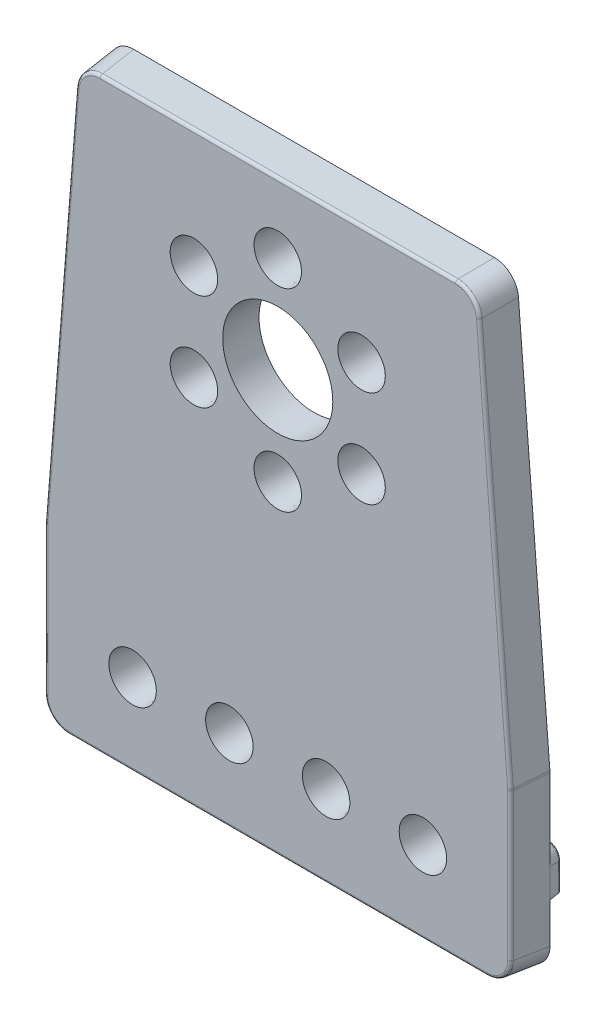
from build123d import *

# Parameters (mm, degrees)
BOSS_EXTRUDE1_DEPTH            = 3
BOSS_EXTRUDE1_DRAFT            = -5
SKETCH2_W                      = 39
SKETCH2_H                      = 3.4
BOSS_EXTRUDE2_DEPTH            = 1
BOSS_EXTRUDE2_TAPER            = 5
HOLE1_AT_2_COUNT               = 2
HOLE1_AT_2_PITCH               = 8
HOLE1_AT_3_COUNT               = 2
HOLE1_AT_3_PITCH               = 13.856406461
HOLE1_AT_4_COUNT               = 2
HOLE1_AT_4_PITCH               = 13.856406461
HOLE1_AT_5_COUNT               = 2
HOLE1_AT_5_PITCH               = 8
HOLE1_AT_6_COUNT               = 2
HOLE1_AT_6_PITCH               = 16
F_9_1_9_1_DIAMETER_HOLE1_D     = 9.1
F_9_1_9_1_DIAMETER_HOLE1_DEPTH = 4.000025
FILLET2_R                      = 1
FILLET3_R                      = 2
FILLET4_R                      = 0.250154439


with BuildPart() as part:
    # Sketch1 → Boss-Extrude1 (with draft: the straight prism first)
    with BuildSketch(Plane(origin=(0, 0, 0), x_dir=(-1, 0, 0), z_dir=(0, 0, -1))):
        Polygon((19.5, -20.5), (16.75, 14), (-16.75, 14), (-19.5, -20.5), (-19.5, -35), (19.5, -35), align=None)
    extrude(amount=-BOSS_EXTRUDE1_DEPTH)
    # Boss-Extrude1: the draft: its side faces are tilted about the plane it starts from
    boss_extrude1_sides = [part.faces().sort_by_distance(p)[0] for p in [
        (-18.125, -3.25, 1.5),
        (0, 14, 1.5),
        (18.125, -3.25, 1.5),
        (19.5, -27.75, 1.5),
        (0, -35, 1.5),
        (-19.5, -27.75, 1.5),
    ]]
    draft(boss_extrude1_sides, Plane(origin=(0, 0, 0), x_dir=(-1, 0, 0), z_dir=(0, 0, -1)), BOSS_EXTRUDE1_DRAFT)

    # Sketch2 → Boss-Extrude2 (add)
    with BuildSketch(Plane(origin=(0, 0, 0), x_dir=(-1, 0, 0), z_dir=(0, 0, -1))):
        with Locations((0, -28)):
            Rectangle(SKETCH2_W, SKETCH2_H)
    extrude(amount=BOSS_EXTRUDE2_DEPTH, taper=BOSS_EXTRUDE2_TAPER)

    # Sketch3 → Cut-Revolve1 (revolve, cut)
    with BuildSketch(Plane.XZ.offset(28), mode=Mode.PRIVATE) as cut_revolve1_sk:
        Polygon((-2.03753401, 3), (-4, 3), (-4, -1), (-2.212511337, -1), (-2.3, 0), align=None)
    revolve(cut_revolve1_sk.sketch.rotate(Axis((-4, -28, 3), (0, 0, -1)), 90), axis=Axis((-4, -28, 3), (0, 0, -1)), mode=Mode.SUBTRACT)

    # Sketch4 → Cut-Revolve2 (revolve, cut)
    with BuildSketch(Plane.XZ.offset(28), mode=Mode.PRIVATE) as cut_revolve2_sk:
        Polygon((-10.03753401, 3), (-12, 3), (-12, -1), (-10.212511337, -1), (-10.3, 0), align=None)
    revolve(cut_revolve2_sk.sketch.rotate(Axis((-12, -28, 3), (0, 0, -1)), 90), axis=Axis((-12, -28, 3), (0, 0, -1)), mode=Mode.SUBTRACT)

    # Sketch5 → Cut-Revolve3 (revolve, cut)
    with BuildSketch(Plane.XZ.offset(28), mode=Mode.PRIVATE) as cut_revolve3_sk:
        Polygon((5.96246599, 3), (4, 3), (4, -1), (5.787488663, -1), (5.7, 0), align=None)
    revolve(cut_revolve3_sk.sketch.rotate(Axis((4, -28, 3), (0, 0, -1)), 90), axis=Axis((4, -28, 3), (0, 0, -1)), mode=Mode.SUBTRACT)

    # Sketch6 → Cut-Revolve4 (revolve, cut)
    with BuildSketch(Plane.XZ.offset(28), mode=Mode.PRIVATE) as cut_revolve4_sk:
        Polygon((13.96246599, 3), (12, 3), (12, -1), (13.787488663, -1), (13.7, 0), align=None)
    revolve(cut_revolve4_sk.sketch.rotate(Axis((12, -28, 3), (0, 0, -1)), 90), axis=Axis((12, -28, 3), (0, 0, -1)), mode=Mode.SUBTRACT)

    # Sketch7 → Hole1 (revolve, cut)
    with BuildSketch(Plane(origin=(-6.92820323, 4, 3), x_dir=(0, -1, 0), z_dir=(1, 0, 0))):
        Polygon((0, 0), (0, 3), (1.7, 3), (1.96246599, 0), align=None)
    hole1 = revolve(axis=Axis((-6.92820323, 4, -107), (0, 0, 1)), mode=Mode.SUBTRACT)

    # Hole1 at 2: Hole1 ×2
    with Locations(*[Vector(0.8660254037844387, 0.4999999999999999, 0) * (i * HOLE1_AT_2_PITCH) for i in range(1, HOLE1_AT_2_COUNT)]):
        add(hole1, mode=Mode.SUBTRACT)

    # Hole1 at 3: Hole1 ×2
    with Locations(*[Vector(0.49999999999999983, -0.8660254037844388, 0) * (i * HOLE1_AT_3_PITCH) for i in range(1, HOLE1_AT_3_COUNT)]):
        add(hole1, mode=Mode.SUBTRACT)

    # Hole1 at 4: Hole1 ×2
    with Locations(*[(i * HOLE1_AT_4_PITCH, 0, 0) for i in range(1, HOLE1_AT_4_COUNT)]):
        add(hole1, mode=Mode.SUBTRACT)

    # Hole1 at 5: Hole1 ×2
    with Locations(*[(0, -i * HOLE1_AT_5_PITCH, 0) for i in range(1, HOLE1_AT_5_COUNT)]):
        add(hole1, mode=Mode.SUBTRACT)

    # Hole1 at 6: Hole1 ×2
    with Locations(*[Vector(0.8660254037844387, -0.5, 0) * (i * HOLE1_AT_6_PITCH) for i in range(1, HOLE1_AT_6_COUNT)]):
        add(hole1, mode=Mode.SUBTRACT)

    # Ø9.1 (9.1) Diameter Hole1
    with Locations(Plane.XY.offset(3)):
        with Locations((0, 0)):
            Hole(F_9_1_9_1_DIAMETER_HOLE1_D / 2, depth=F_9_1_9_1_DIAMETER_HOLE1_DEPTH)

    # Fillet2
    fillet2_edges = [part.edges().sort_by_distance(p)[0] for p in [
        (19.456255668, -26.343744332, -0.5),
    ]]
    fillet(fillet2_edges, radius=FILLET2_R)

    # Fillet3
    # the kernel refuses this fillet: 2 mm, written as the material it takes off along each edge
    with BuildSketch(Plane(origin=(19.517274298, -20.499312622, -0.197446131), x_dir=(0.00030226286945323497, -0.9999939862011833, -0.0034548804068170054), z_dir=(-0.08715521861055191, -0.003468077488704389, 0.9961887071772493)), Plane(origin=(-19.517274298, -20.499312622, -0.197446131), x_dir=(0.07915633279107509, 0.9968562277382045, -0.003454880406819779), z_dir=(0.08715521861055195, -0.0034680774887046943, 0.9961887071772493))) as fillet3_piece_1:
        with BuildLine():
            CenterArc((FILLET3_R * 0.0396403070859, -FILLET3_R), FILLET3_R, 90, 4.540067567)
            Line((-FILLET3_R * 0.0395159246289, -FILLET3_R * 0.00313777733294), (0, 0))
            Line((0, 0), (FILLET3_R * 0.0396403070859, 0))
        make_face()
    extrude(amount=3.407880694, mode=Mode.SUBTRACT)
    with BuildSketch(Plane(origin=(19.930847672, -35.430847672, -4.924611426), x_dir=(-0.9962234400966148, -0.0075674362784890585, -0.08649619246092513), z_dir=(-0.0868265938642441, 0.08682659386424399, 0.9924325091389677))) as fillet3_piece_2:
        with BuildLine():
            CenterArc((FILLET3_R * 0.992432509139, -FILLET3_R), FILLET3_R, 90, 89.564769998)
            Line((-FILLET3_R * 0.00753863989878, -FILLET3_R * 0.992403876506), (0, 0))
            Line((0, 0), (FILLET3_R * 0.992432509139, 0))
        make_face()
    extrude(amount=12.947200675, mode=Mode.SUBTRACT)
    with BuildSketch(Plane(origin=(17.117827148, 14.398313386, -4.552742838), x_dir=(0.08617201419545477, -0.9930695507218015, -0.07992028152288816), z_dir=(-0.08022556401472408, -0.08687481666807954, 0.9929836983089939)), Plane(origin=(-17.117827148, 14.398313386, -4.552742838), x_dir=(0.9967767347197262, 0.006992118619052054, -0.07992028152288819), z_dir=(0.08022556401472414, -0.08687481666807953, 0.9929836983089939))) as fillet3_piece_3:
        with BuildLine():
            CenterArc((FILLET3_R * 0.916982392707, -FILLET3_R), FILLET3_R, 90, 85.04055089)
            Line((-FILLET3_R * 0.0792737400553, -FILLET3_R * 0.913549332369), (0, 0))
            Line((0, 0), (FILLET3_R * 0.916982392707, 0))
        make_face()
    extrude(amount=12.191021561, mode=Mode.SUBTRACT)
    with BuildSketch(Plane(origin=(-19.930847672, -35.430847672, -4.924611426), x_dir=(0.9962234400966149, -0.007567436278489008, -0.08649619246092499), z_dir=(0.08682659386424396, 0.08682659386424399, 0.9924325091389677))) as fillet3_piece_4:
        with BuildLine():
            CenterArc((FILLET3_R * 0.992432509139, FILLET3_R), FILLET3_R, 180.435230002, 89.564769998)
            Line((-FILLET3_R * 0.00753863989878, FILLET3_R * 0.992403876506), (0, 0))
            Line((0, 0), (FILLET3_R * 0.992432509139, 0))
        make_face()
    extrude(amount=12.947200675, mode=Mode.SUBTRACT)

    # Fillet4
    fillet4_edges = [part.edges().sort_by_distance(p)[0] for p in [
        (0, -29.612511336, -1),
        (5.787488663, -28, -1),
        (2.212511337, -28, -1),
        (-5.787488663, -28, -1),
        (-2.212511337, -28, -1),
        (0, -26.387488664, -1),
        (-16.091911898, -29.612511336, -1),
        (-19.412511336, -28, -1),
        (-13.787488663, -28, -1),
        (-10.212511337, -28, -1),
        (-16.091911898, -26.387488664, -1),
        (16.091911898, -29.612511336, -1),
        (19.412511336, -28.498097349, -1),
        (19.121190108, -26.678809895, -1),
        (13.787488663, -28, -1),
        (10.212511337, -28, -1),
        (15.593814549, -26.387488664, -1),
        (-8, -29.612511336, -1),
        (-8, -26.387488664, -1),
        (8, -29.612511336, -1),
        (8, -26.387488664, -1),
        (-18.65489155, -34.15489155, 3),
        (-19.237534009, -26.667434871, 3),
        (0, -34.737534009, 3),
        (-19.23595851, -20.51050673, 3),
        (18.65489155, -34.15489155, 3),
        (-17.942525906, -4.263978746, 3),
        (19.237534009, -26.667434871, 3),
        (-16.020097276, 13.209601502, 3),
        (19.23595851, -20.51050673, 3),
        (0, 13.737534009, 3),
        (17.942525906, -4.263978746, 3),
        (16.020097276, 13.209601502, 3),
    ]]
    fillet(fillet4_edges, radius=FILLET4_R)


solid = part.part
